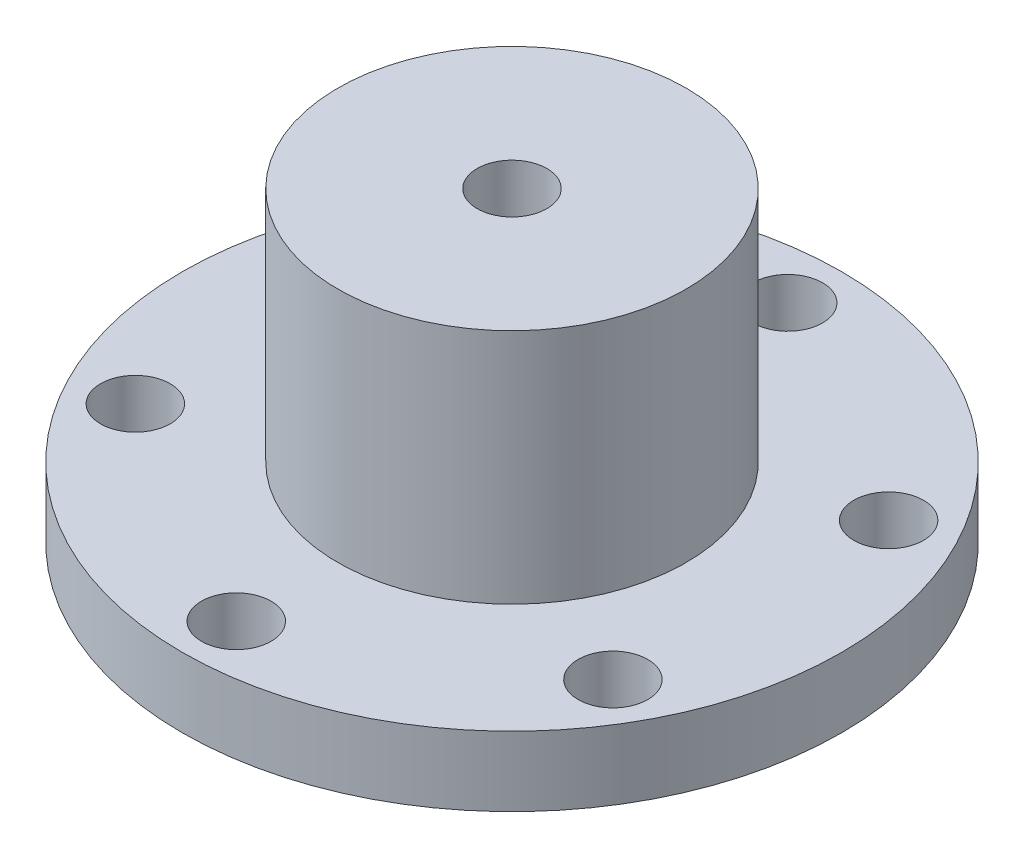
from build123d import *

# Parameters (mm, degrees)
SKETCH2_R          = 3
CUT_EXTRUDE1_DEPTH = 46.047530454


with BuildPart() as part:
    # Sketch1 → Revolve1 (revolve)
    with BuildSketch(Plane(origin=(0, 0, 0), x_dir=(0, 0, -1), z_dir=(1, 0, 0))):
        Polygon((-3, 0), (-28.4, 0), (-28.4, 6), (-15, 6), (-15, 26.4), (-3, 26.4), align=None)
    revolve(axis=Axis((0, 0, 0), (0, 1, 0)))

    # Sketch2 → Cut-Extrude1 (cut, through all)
    with BuildSketch(Plane(origin=(0, 6, 0), x_dir=(1, 0, 0), z_dir=(0, 1, 0))):
        with Locations((0, 23.75)):
            Circle(SKETCH2_R)
        with Locations((20.56810334, 11.875)):
            Circle(SKETCH2_R)
        with Locations((20.56810334, -11.875)):
            Circle(SKETCH2_R)
        with Locations((0, -23.75)):
            Circle(SKETCH2_R)
        with Locations((-20.56810334, -11.875)):
            Circle(SKETCH2_R)
        with Locations((-20.56810334, 11.875)):
            Circle(SKETCH2_R)
    extrude(amount=-CUT_EXTRUDE1_DEPTH, mode=Mode.SUBTRACT)


solid = part.part
